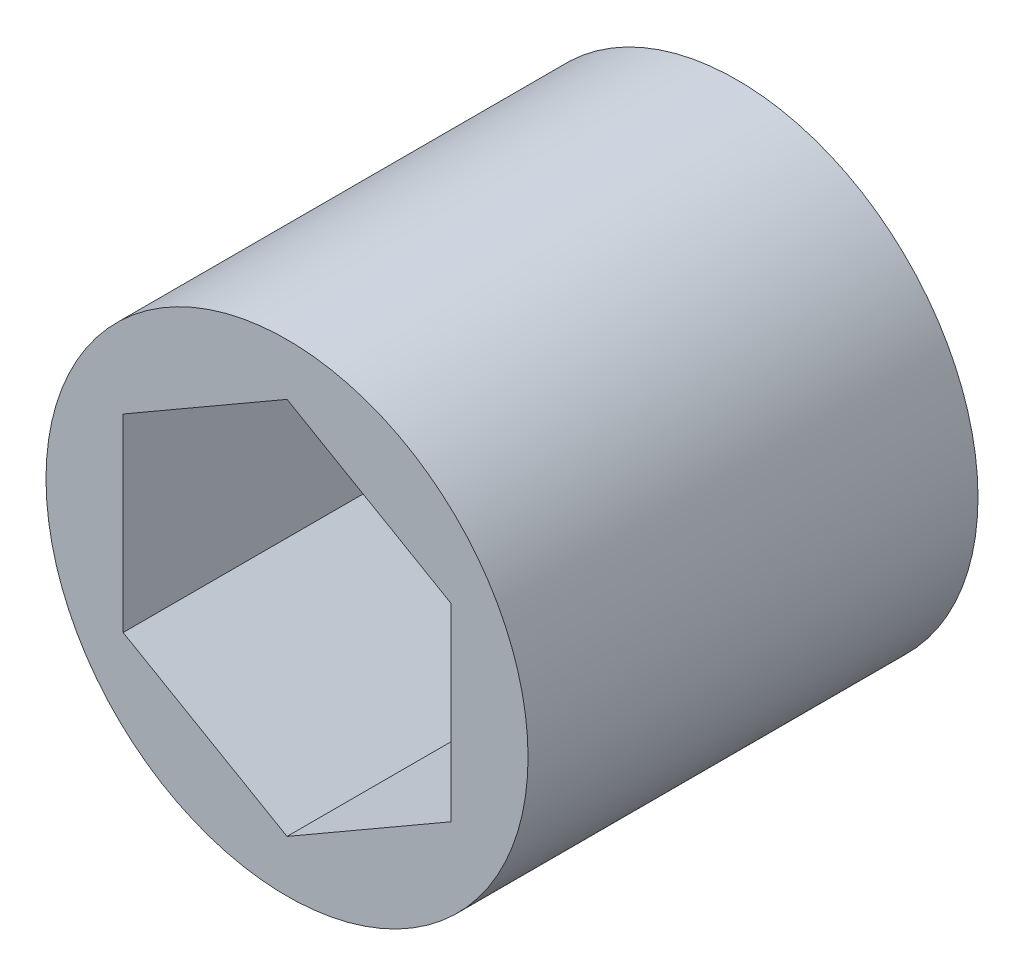
from build123d import *

# Parameters (mm, degrees)
SKETCH1_R           = 9.525
BOSS_EXTRUDE1_DEPTH = 8.89


with BuildPart() as part:
    # Sketch1 → Boss-Extrude1 (new, symmetric)
    with BuildSketch(Plane.XY):
        Circle(SKETCH1_R)
        Polygon((0, 7.478995387), (-6.477, 3.739497694), (-6.477, -3.739497694), (0, -7.478995387), (6.477, -3.739497694), (6.477, 3.739497694), align=None, mode=Mode.SUBTRACT)
    extrude(amount=BOSS_EXTRUDE1_DEPTH, both=True)


solid = part.part
